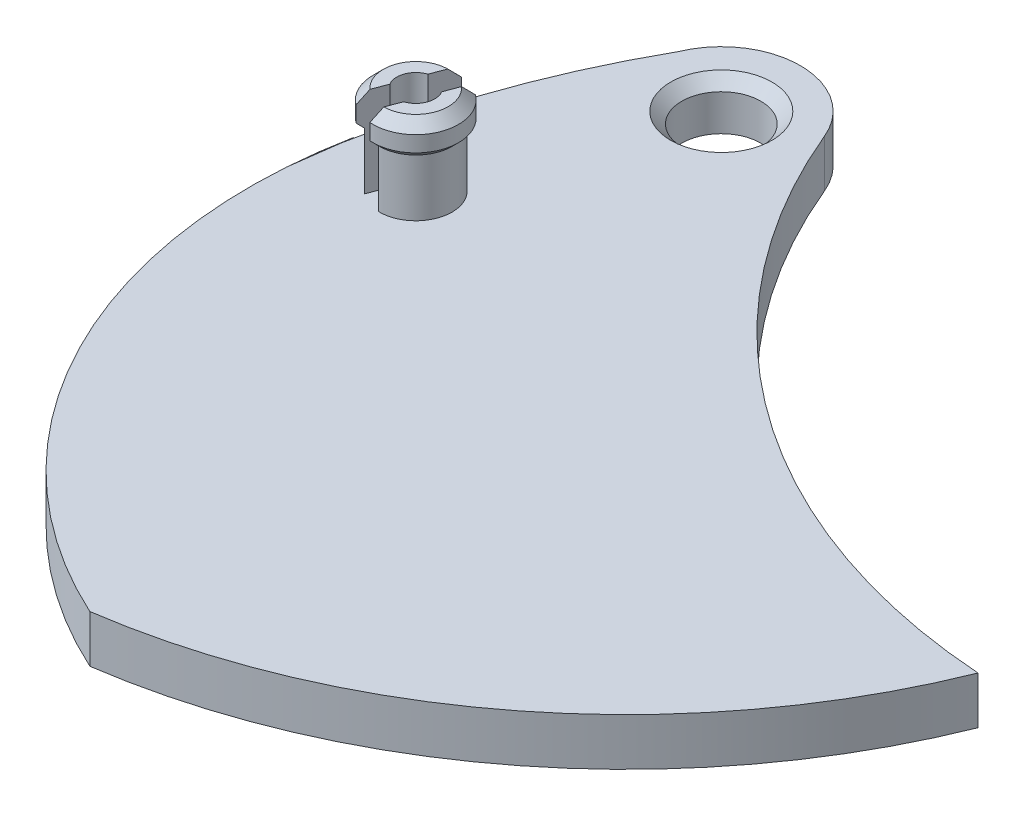
from build123d import *

# Parameters (mm, degrees)
SKETCH1_R           = 2.5
BOSS_EXTRUDE2_DEPTH = 3
SKETCH2_R           = 2.3
BOSS_EXTRUDE3_DEPTH = 4
SKETCH3_R           = 2.7
BOSS_EXTRUDE4_DEPTH = 1
CHAMFER1_SIZE       = 0.4
SKETCH4_R           = 2.05
BOSS_EXTRUDE5_DEPTH = 0.65
CHAMFER2_SIZE       = 0.65
CUT_EXTRUDE1_REACH  = 75.679
SKETCH7_R           = 1.2
CUT_EXTRUDE2_DEPTH  = 5.65
CHAMFER3_SIZE       = 0.7


with BuildPart() as part:
    # Sketch1 → Boss-Extrude2 (new body)
    with BuildSketch(Plane(origin=(0, 0, 0), x_dir=(1, 0, 0), z_dir=(0, 1, 0))):
        with BuildLine():
            ThreePointArc((-6.116355206, -22.650875646), (-26.749356674, -15.248026431), (-40.382392076, 1.917732271))
            ThreePointArc((-40.382392076, 1.917732271), (-44.99801909, 4.999999608), (-49.616086933, 1.921390494))
            ThreePointArc((-49.616086933, 1.921390494), (-53.104028793, -5.679123666), (-55.276433102, -13.75465544))
            ThreePointArc((-55.276433102, -13.75465544), (-55.245679697, -13.416577441), (-55.192056675, -13.081365453))
            ThreePointArc((-55.192056675, -13.081365453), (-52.322107352, -33.280314666), (-37.56541985, -47.368406531))
            ThreePointArc((-37.56541985, -47.368406531), (-18.529366308, -39.223016825), (-6.116355206, -22.650875646))
        make_face()
        with Locations(Location((-45, 0, 0), (0, 0, 270))):
            Circle(SKETCH1_R, mode=Mode.SUBTRACT)
    extrude(amount=-BOSS_EXTRUDE2_DEPTH)

    # Sketch2 → Boss-Extrude3 (add)
    with BuildSketch(Plane(origin=(0, 0, 0), x_dir=(1, 0, 0), z_dir=(0, 1, 0))):
        with Locations(Location((-50.284485705, -14.03831225, 0), (0, 0, 270))):
            Circle(SKETCH2_R)
    extrude(amount=BOSS_EXTRUDE3_DEPTH)

    # Sketch3 → Boss-Extrude4 (add)
    with BuildSketch(Plane(origin=(0, 4, 0), x_dir=(1, 0, 0), z_dir=(0, 1, 0))):
        with Locations(Location((-50.284485705, -14.03831225, 0), (0, 0, 270))):
            Circle(SKETCH3_R)
    extrude(amount=BOSS_EXTRUDE4_DEPTH)

    # Chamfer1
    chamfer1_edges = [part.edges().sort_by_distance(p)[0] for p in [
        (-50.284485705, 4, 11.73831225),
    ]]
    chamfer(chamfer1_edges, length=CHAMFER1_SIZE - 0.0001)  # a hair under: the kernel refuses the full size

    # Sketch4 → Boss-Extrude5 (add)
    with BuildSketch(Plane(origin=(0, 5, 0), x_dir=(1, 0, 0), z_dir=(0, 1, 0))):
        with Locations(Location((-50.284485705, -14.03831225, 0), (0, 0, 270))):
            Circle(SKETCH4_R)
    extrude(amount=BOSS_EXTRUDE5_DEPTH)

    # Chamfer2
    chamfer2_edges = [part.edges().sort_by_distance(p)[0] for p in [
        (-50.284485705, 5, 11.98831225),
    ]]
    chamfer(chamfer2_edges, length=CHAMFER2_SIZE - 0.0001)  # a hair under: the kernel refuses the full size

    # Cut-Extrude1: up to this face of the body (flat: up to its plane)
    cut_extrude1_end = Plane(part.part.faces().sort_by_distance((-35.615181699, 0, 24.623132095))[0])
    # Sketch6 → Cut-Extrude1 (cut, up to the picked face)
    with BuildSketch(Plane(origin=(0, 5.65, 0), x_dir=(1, 0, 0), z_dir=(0, 1, 0)), mode=Mode.PRIVATE) as cut_extrude1_sk1:
        with BuildLine():
            Line((-50.254713835, -16.088096052), (-48.910426349, -12.516977019))
            ThreePointArc((-48.910426349, -12.516977019), (-49.562272658, -12.119742909), (-50.314257574, -11.988528448))
            Line((-50.314257574, -11.988528448), (-51.65854506, -15.559647482))
            ThreePointArc((-51.65854506, -15.559647482), (-51.006698751, -15.956881591), (-50.254713835, -16.088096052))
        make_face()
    cut_extrude1_tool1 = split(extrude(cut_extrude1_sk1.sketch, amount=-CUT_EXTRUDE1_REACH, mode=Mode.PRIVATE), bisect_by=cut_extrude1_end, keep=Keep.BOTH, mode=Mode.PRIVATE)
    # Sketch6 → Cut-Extrude1 (cut, up to the picked face)
    with BuildSketch(Plane(origin=(0, 5.65, 0), x_dir=(1, 0, 0), z_dir=(0, 1, 0)), mode=Mode.PRIVATE) as cut_extrude1_sk2:
        with BuildLine():
            Line((-48.910426349, -12.516977019), (-47.84100442, -9.676042289))
            ThreePointArc((-47.84100442, -9.676042289), (-48.52299047, -9.358874834), (-49.244835645, -9.147593719))
            Line((-49.244835645, -9.147593719), (-50.314257574, -11.988528448))
            ThreePointArc((-50.314257574, -11.988528448), (-49.562272658, -12.119742909), (-48.910426349, -12.516977019))
        make_face()
    cut_extrude1_tool2 = split(extrude(cut_extrude1_sk2.sketch, amount=-CUT_EXTRUDE1_REACH, mode=Mode.PRIVATE), bisect_by=cut_extrude1_end, keep=Keep.BOTH, mode=Mode.PRIVATE)
    # Sketch6 → Cut-Extrude1 (cut, up to the picked face)
    with BuildSketch(Plane(origin=(0, 5.65, 0), x_dir=(1, 0, 0), z_dir=(0, 1, 0)), mode=Mode.PRIVATE) as cut_extrude1_sk3:
        with BuildLine():
            Line((-51.324135764, -18.929030782), (-50.254713835, -16.088096052))
            ThreePointArc((-50.254713835, -16.088096052), (-51.006698751, -15.956881591), (-51.65854506, -15.559647482))
            Line((-51.65854506, -15.559647482), (-52.727966989, -18.400582211))
            ThreePointArc((-52.727966989, -18.400582211), (-52.04598094, -18.717749667), (-51.324135764, -18.929030782))
        make_face()
    cut_extrude1_tool3 = split(extrude(cut_extrude1_sk3.sketch, amount=-CUT_EXTRUDE1_REACH, mode=Mode.PRIVATE), bisect_by=cut_extrude1_end, keep=Keep.BOTH, mode=Mode.PRIVATE)
    # Sketch6 → Cut-Extrude1 (cut, up to the picked face)
    with BuildSketch(Plane(origin=(0, 5.65, 0), x_dir=(1, 0, 0), z_dir=(0, 1, 0)), mode=Mode.PRIVATE) as cut_extrude1_sk4:
        with BuildLine():
            Line((-48.910426349, -12.516977019), (-47.84100442, -9.676042289))
            ThreePointArc((-47.84100442, -9.676042289), (-48.52299047, -9.358874834), (-49.244835645, -9.147593719))
            Line((-49.244835645, -9.147593719), (-50.314257574, -11.988528448))
            ThreePointArc((-50.314257574, -11.988528448), (-49.562272658, -12.119742909), (-48.910426349, -12.516977019))
        make_face()
    cut_extrude1_tool4 = split(extrude(cut_extrude1_sk4.sketch, amount=-CUT_EXTRUDE1_REACH, mode=Mode.PRIVATE), bisect_by=cut_extrude1_end, keep=Keep.BOTH, mode=Mode.PRIVATE)
    # Sketch6 → Cut-Extrude1 (cut, up to the picked face)
    with BuildSketch(Plane(origin=(0, 5.65, 0), x_dir=(1, 0, 0), z_dir=(0, 1, 0)), mode=Mode.PRIVATE) as cut_extrude1_sk5:
        with BuildLine():
            Line((-51.324135764, -18.929030782), (-50.254713835, -16.088096052))
            ThreePointArc((-50.254713835, -16.088096052), (-51.006698751, -15.956881591), (-51.65854506, -15.559647482))
            Line((-51.65854506, -15.559647482), (-52.727966989, -18.400582211))
            ThreePointArc((-52.727966989, -18.400582211), (-52.04598094, -18.717749667), (-51.324135764, -18.929030782))
        make_face()
    cut_extrude1_tool5 = split(extrude(cut_extrude1_sk5.sketch, amount=-CUT_EXTRUDE1_REACH, mode=Mode.PRIVATE), bisect_by=cut_extrude1_end, keep=Keep.BOTH, mode=Mode.PRIVATE)
    add(cut_extrude1_tool1.solids().sort_by(Axis((-50.284486, 5.65, 14.038312), (0, -1, 0)))[0], mode=Mode.SUBTRACT)
    add(cut_extrude1_tool2.solids().sort_by(Axis((-49.05426, 5.65, 10.770199), (0, -1, 0)))[0], mode=Mode.SUBTRACT)
    add(cut_extrude1_tool3.solids().sort_by(Axis((-51.514712, 5.65, 17.306426), (0, -1, 0)))[0], mode=Mode.SUBTRACT)
    add(cut_extrude1_tool4.solids().sort_by(Axis((-49.05426, 5.65, 10.770199), (0, -1, 0)))[0], mode=Mode.SUBTRACT)
    add(cut_extrude1_tool5.solids().sort_by(Axis((-51.514712, 5.65, 17.306426), (0, -1, 0)))[0], mode=Mode.SUBTRACT)

    # Sketch7 → Cut-Extrude2 (cut)
    with BuildSketch(Plane(origin=(0, 5.65, 0), x_dir=(1, 0, 0), z_dir=(0, 1, 0))):
        with Locations((-50.284485705, -14.03831225)):
            Circle(SKETCH7_R)
    extrude(amount=-CUT_EXTRUDE2_DEPTH, mode=Mode.SUBTRACT)

    # Chamfer3
    chamfer3_edges = [part.edges().sort_by_distance(p)[0] for p in [
        (-45, 0, -2.5),
    ]]
    chamfer(chamfer3_edges, length=CHAMFER3_SIZE)


solid = part.part
